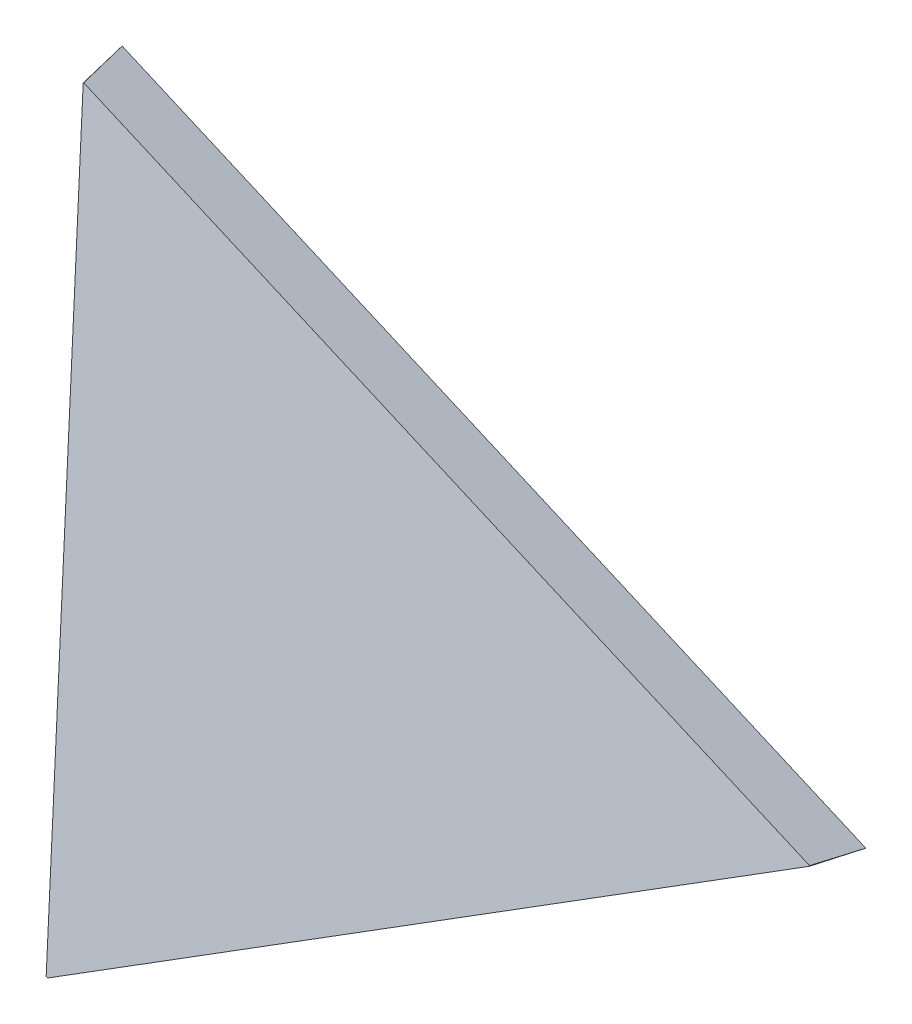
from build123d import *

# Parameters (mm, degrees)
BOSS_EXTRUDE1_DEPTH = 70
CHAMFER1_SIZE2      = 4.18941816
CHAMFER1_SIZE       = 70
CHAMFER2_SIZE       = 6.666257335
CHAMFER2_SIZE_2     = 70
CUT_EXTRUDE1_DEPTH  = 10
CUT_EXTRUDE2_DEPTH  = 10
SKETCH4_W           = 287.422720902
SKETCH4_H           = 893.518312169
CUT_EXTRUDE3_DEPTH  = 10


# Some blends are built 0.0001 mm under size
with BuildPart() as part:
    # Sketch1 → Boss-Extrude1 (new body)
    with BuildSketch(Plane(origin=(231.948409601, 267.750179411, 1224.939426156), x_dir=(0.9836670614243895, -0.018848869033306223, -0.17900791157061058), z_dir=(0.17900684147746093, 0.20663786272562784, 0.9619029807586875))):
        Polygon((-6114.579700227, 916.675736405), (-6017.047344534, 65.828535372), (-5261.298623968, 468.69003921), align=None)
    extrude(amount=BOSS_EXTRUDE1_DEPTH)

    # Chamfer1
    chamfer1_edges = [part.edges().sort_by_distance(p)[0] for p in [
        (-5363.622839272, 1067.033331681, 2167.324875996),
    ]]
    chamfer1_side = [part.faces().sort_by_distance(p)[0] for p in [
        (-5363.637837962, 1067.016017832, 2167.24427972),
    ]]
    chamfer(chamfer1_edges, length=CHAMFER1_SIZE - 0.0001, length2=CHAMFER1_SIZE2 - 0.0001, reference=chamfer1_side[0])  # a hair under: the kernel refuses the full size

    # Chamfer2
    # the kernel refuses this chamfer: 70, 6.666257335 mm, written as the material it takes off along each edge
    with BuildSketch(Plane(origin=(-5831.876326045, 379.315966254, 2402.202019272), x_dir=(-0.37796472427930605, 0.8862370425990936, 0.267818168774414), z_dir=(0.8591676949824762, 0.4435312395800335, -0.255168398151295))) as chamfer2_piece_1:
        Polygon((CHAMFER2_SIZE * 0.92779638202, -CHAMFER2_SIZE * 0.373086951719), (-CHAMFER2_SIZE_2 * 0.373086951713, -CHAMFER2_SIZE_2 * 0.927796382005), (0, 0), align=None)
    extrude(amount=1215.290815937, mode=Mode.SUBTRACT)
    with BuildSketch(Plane(origin=(-5810.651127776, 1466.498755071, 2164.701368848), x_dir=(-0.1825618043812556, -0.20697447902057858, -0.9611621885068203), z_dir=(0.13076019619656676, -0.9740181607293223, 0.184906445696475))) as chamfer2_piece_2:
        Polygon((CHAMFER2_SIZE_2 * 0.999993350078, CHAMFER2_SIZE_2 * 0.00364688918346), (-CHAMFER2_SIZE * 0.00364688918357, CHAMFER2_SIZE * 0.999993350094), (0, 0), align=None)
    extrude(amount=1215.290815937, mode=Mode.SUBTRACT)

    # Sketch2 → Cut-Extrude1 (cut)
    with BuildSketch(Plane(origin=(-1155.31957462, -2341.467412338, 1286.584724908), x_dir=(0.9178561698216066, -0.3478582739738773, 0.1911404529353356), z_dir=(-0.39691315362483304, -0.8044174401239645, 0.4420096497860625))):
        Polygon((-4919.324722598, 2288.84825515), (-4917.313875734, 2288.259664395), (-4938.404193289, 2220.173354917), align=None)
    extrude(amount=CUT_EXTRUDE1_DEPTH, mode=Mode.SUBTRACT)

    # Sketch3 → Cut-Extrude2 (cut)
    with BuildSketch(Plane(origin=(-4820.811559407, -663.513212633, 188.265036569), x_dir=(-0.038297874166628845, -0.005271134374818051, -0.9992524645837606), z_dir=(0.9899202066384638, 0.1362478347188717, -0.03865891906507896))):
        Polygon((-2346.226398356, 930.896979041), (-1894.241052266, 2187.396241778), (-1814.981817773, 1495.770397412), align=None)
    extrude(amount=CUT_EXTRUDE2_DEPTH, mode=Mode.SUBTRACT)

    # Sketch4 → Cut-Extrude3 (cut)
    with BuildSketch(Plane(origin=(-1646.015630594, 3413.926203867, 236.836708654), x_dir=(0.9011742428578655, 0.43241771341973545, 0.029998418798336916), z_dir=(-0.43345701518092067, 0.8990134934757245, 0.06236789670191585))):
        with Locations((-4715.577586911, -1688.111490452)):
            Rectangle(SKETCH4_W, SKETCH4_H)
    extrude(amount=CUT_EXTRUDE3_DEPTH, mode=Mode.SUBTRACT)


solid = part.part
